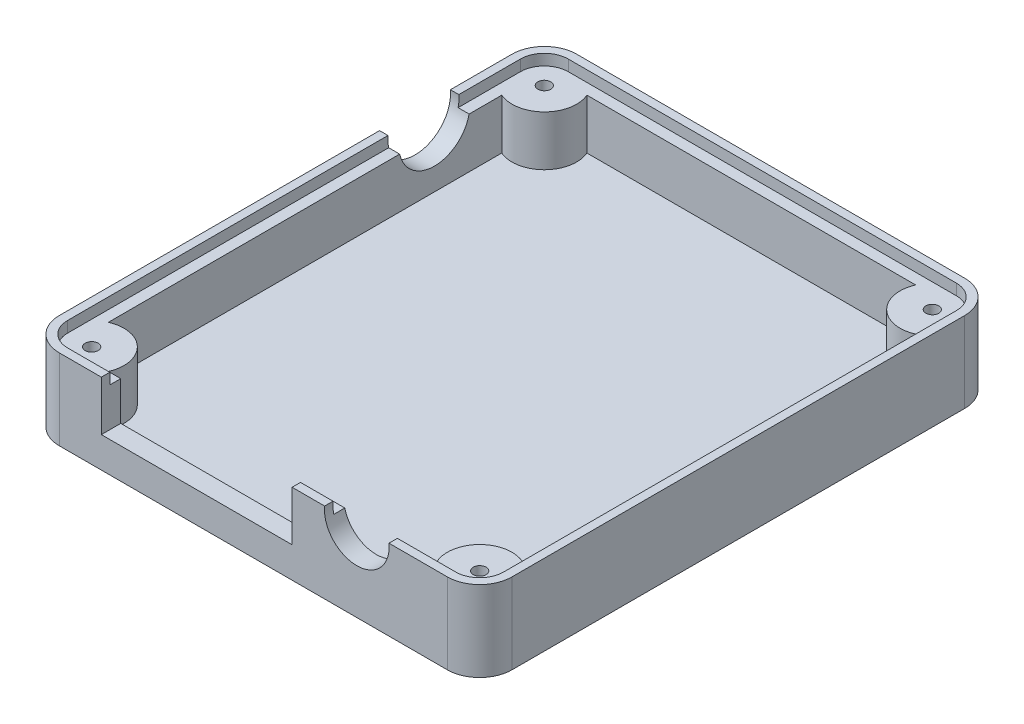
from build123d import *

# Parameters (mm, degrees)
SKETCH1_W               = 70
SKETCH1_H               = 80
BOSS_EXTRUDE1_DEPTH     = 21.5
FILLET1_R               = 5
SHELL1_T                = 3
BOSS_EXTRUDE2_REACH     = 59.335
SKETCH3_R               = 5
SPLIT2_SURFACE_1_BACK   = 109.454
SPLIT2_SURFACE_1_DEPTH  = 218.908
SPLIT2_SURFACE_2_BACK   = 109.454
SPLIT2_SURFACE_2_DEPTH  = 218.908
SKETCH4_R               = 1
CUT_EXTRUDE1_DEPTH      = 58.334544561
SKETCH5_R               = 3
CUT_EXTRUDE2_DEPTH      = 7.75
SKETCH6_OUTSIDE_W       = 93.69
SKETCH6_OUTSIDE_H       = 103.69
CUT_EXTRUDE3_DEPTH      = 2
BOSS_EXTRUDE3_START     = 1.7
BOSS_EXTRUDE3_DEPTH     = 1.7
SKETCH8_R               = 5.5
CUT_EXTRUDE4_DEPTH      = 10
SKETCH9_R               = 5
SKETCH9_W               = 20
SKETCH9_H               = 12
CUT_EXTRUDE5_DEPTH      = 10
BOSS_EXTRUDE4_OUTLINE_W = 20
BOSS_EXTRUDE4_OUTLINE_H = 1.5
BOSS_EXTRUDE4_DEPTH     = 7.75
SKETCH12_W              = 29.5
SKETCH12_H              = 12
CUT_EXTRUDE6_DEPTH      = 10
BOSS_EXTRUDE5_DEPTH     = 5


# Read off the part's stored shape, not the designer's step: Boss-Extrude4
with BuildPart() as part:
    # Sketch1 → Boss-Extrude1 (new body)
    with BuildSketch(Plane(origin=(0, 0, 0), x_dir=(1, 0, 0), z_dir=(0, 1, 0))):
        Rectangle(SKETCH1_W, SKETCH1_H)
    extrude(amount=BOSS_EXTRUDE1_DEPTH)

    # Fillet1
    fillet1_edges = [part.edges().sort_by_distance(p)[0] for p in [
        (-35, 10.75, -40),
        (35, 10.75, -40),
        (35, 10.75, 40),
        (-35, 10.75, 40),
    ]]
    fillet(fillet1_edges, radius=FILLET1_R)

    # Shell1 (no face opened: a closed hollow body)
    add(offset(amount=-SHELL1_T, mode=Mode.PRIVATE), mode=Mode.SUBTRACT)

    # Sketch3 → Boss-Extrude2 (add, up to next)
    with BuildSketch(Plane(origin=(0, 21.5, 0), x_dir=(1, 0, 0), z_dir=(0, 1, 0)), mode=Mode.PRIVATE) as boss_extrude2_sk1:
        with Locations((-30, 35)):
            Circle(SKETCH3_R)
    boss_extrude2_tool1 = extrude(boss_extrude2_sk1.sketch, amount=-BOSS_EXTRUDE2_REACH, mode=Mode.PRIVATE) - part.part
    # Sketch3 → Boss-Extrude2 (add, up to next)
    with BuildSketch(Plane(origin=(0, 21.5, 0), x_dir=(1, 0, 0), z_dir=(0, 1, 0)), mode=Mode.PRIVATE) as boss_extrude2_sk2:
        with Locations((30, 35)):
            Circle(SKETCH3_R)
    boss_extrude2_tool2 = extrude(boss_extrude2_sk2.sketch, amount=-BOSS_EXTRUDE2_REACH, mode=Mode.PRIVATE) - part.part
    # Sketch3 → Boss-Extrude2 (add, up to next)
    with BuildSketch(Plane(origin=(0, 21.5, 0), x_dir=(1, 0, 0), z_dir=(0, 1, 0)), mode=Mode.PRIVATE) as boss_extrude2_sk3:
        with Locations((30, -35)):
            Circle(SKETCH3_R)
    boss_extrude2_tool3 = extrude(boss_extrude2_sk3.sketch, amount=-BOSS_EXTRUDE2_REACH, mode=Mode.PRIVATE) - part.part
    # Sketch3 → Boss-Extrude2 (add, up to next)
    with BuildSketch(Plane(origin=(0, 21.5, 0), x_dir=(1, 0, 0), z_dir=(0, 1, 0)), mode=Mode.PRIVATE) as boss_extrude2_sk4:
        with Locations((-30, -35)):
            Circle(SKETCH3_R)
    boss_extrude2_tool4 = extrude(boss_extrude2_sk4.sketch, amount=-BOSS_EXTRUDE2_REACH, mode=Mode.PRIVATE) - part.part
    add(boss_extrude2_tool1.solids().sort_by_distance((-30, 21.5, -35))[0])
    add(boss_extrude2_tool2.solids().sort_by_distance((30, 21.5, -35))[0])
    add(boss_extrude2_tool3.solids().sort_by_distance((30, 21.5, 35))[0])
    add(boss_extrude2_tool4.solids().sort_by_distance((-30, 21.5, 35))[0])


with BuildPart() as body_2:
    # Split2: the piece behind the surface
    add(part.part)
    # Split2 surface: a surface, the sketch's curves swept straight by 218.908 mm
    with BuildLine(Plane(origin=(0, 0, 0), x_dir=(0, 0, -1), z_dir=(1, 0, 0)).offset(-SPLIT2_SURFACE_1_BACK), mode=Mode.PRIVATE) as split2_surface_1_path:
        Line((-40, 10.75), (51.562362236, 10.75))
    split2_surface_1 = Shell.extrude(split2_surface_1_path.wire(), (1 * SPLIT2_SURFACE_1_DEPTH, 0 * SPLIT2_SURFACE_1_DEPTH, 0 * SPLIT2_SURFACE_1_DEPTH))
    split(bisect_by=split2_surface_1, keep=Keep.BOTTOM)


with BuildPart() as part_1:
    add(part.part)

    # Split2: split by a surface, the side it looks to stays
    # Split2 surface: a surface, the sketch's curves swept straight by 218.908 mm
    with BuildLine(Plane(origin=(0, 0, 0), x_dir=(0, 0, -1), z_dir=(1, 0, 0)).offset(-SPLIT2_SURFACE_2_BACK), mode=Mode.PRIVATE) as split2_surface_2_path:
        Line((-40, 10.75), (51.562362236, 10.75))
    split2_surface_2 = Shell.extrude(split2_surface_2_path.wire(), (1 * SPLIT2_SURFACE_2_DEPTH, 0 * SPLIT2_SURFACE_2_DEPTH, 0 * SPLIT2_SURFACE_2_DEPTH))
    split(bisect_by=split2_surface_2, keep=Keep.TOP)


with BuildPart() as cut_extrude1_tool:
    # Sketch4 → Cut-Extrude1 (new, through all)
    with BuildSketch(Plane(origin=(0, 21.5, 0), x_dir=(1, 0, 0), z_dir=(0, 1, 0))):
        with Locations(Location((-30, 35, 0), (0, 0, 270))):
            Circle(SKETCH4_R)
        with Locations(Location((30, 35, 0), (0, 0, 270))):
            Circle(SKETCH4_R)
        with Locations(Location((30, -35, 0), (0, 0, 270))):
            Circle(SKETCH4_R)
        with Locations(Location((-30, -35, 0), (0, 0, 270))):
            Circle(SKETCH4_R)
    extrude(amount=-CUT_EXTRUDE1_DEPTH)


with BuildPart() as part_2:
    add(part_1.part)

    # Cut-Extrude1: cut by cut_extrude1_tool
    add(cut_extrude1_tool.part, mode=Mode.SUBTRACT)

    # Sketch5 → Cut-Extrude2 (cut)
    with BuildSketch(Plane(origin=(0, 21.5, 0), x_dir=(1, 0, 0), z_dir=(0, 1, 0))):
        with Locations(Location((-30, 35, 0), (0, 0, 270))):
            Circle(SKETCH5_R)
        with Locations(Location((30, 35, 0), (0, 0, 270))):
            Circle(SKETCH5_R)
        with Locations(Location((30, -35, 0), (0, 0, 270))):
            Circle(SKETCH5_R)
        with Locations(Location((-30, -35, 0), (0, 0, 270))):
            Circle(SKETCH5_R)
    extrude(amount=-CUT_EXTRUDE2_DEPTH, mode=Mode.SUBTRACT)

    # Sketch6 outside → Cut-Extrude3 (cut)
    with BuildSketch(Plane.XZ.offset(-10.75)):
        Rectangle(SKETCH6_OUTSIDE_W, SKETCH6_OUTSIDE_H)
        with BuildLine():
            Line((-30, -38.5), (30, -38.5))
            ThreePointArc((30, -38.5), (32.474873734, -37.474873734), (33.5, -35))
            Line((33.5, -35), (33.5, 35))
            ThreePointArc((33.5, 35), (32.474873734, 37.474873734), (30, 38.5))
            Line((30, 38.5), (-30, 38.5))
            ThreePointArc((-30, 38.5), (-32.474873734, 37.474873734), (-33.5, 35))
            Line((-33.5, 35), (-33.5, -35))
            ThreePointArc((-33.5, -35), (-32.474873734, -37.474873734), (-30, -38.5))
        make_face(mode=Mode.SUBTRACT)
    extrude(amount=-CUT_EXTRUDE3_DEPTH, mode=Mode.SUBTRACT)


with BuildPart() as body_2_1:
    add(body_2.part)

    # Cut-Extrude1: cut by cut_extrude1_tool
    add(cut_extrude1_tool.part, mode=Mode.SUBTRACT)

    # Sketch7 → Boss-Extrude3 (add)
    with BuildSketch(Plane(origin=(0, 10.75, 0), x_dir=(1, 0, 0), z_dir=(0, 1, 0)).offset(BOSS_EXTRUDE3_START)):
        with BuildLine():
            Line((-30, 40), (30, 40))
            ThreePointArc((30, 40), (33.535533906, 38.535533906), (35, 35))
            Line((35, 35), (35, -35))
            ThreePointArc((35, -35), (33.535533906, -38.535533906), (30, -40))
            Line((30, -40), (-30, -40))
            ThreePointArc((-30, -40), (-33.535533906, -38.535533906), (-35, -35))
            Line((-35, -35), (-35, 35))
            ThreePointArc((-35, 35), (-33.535533906, 38.535533906), (-30, 40))
        make_face()
        with BuildLine():
            Line((30, 38.7), (-30, 38.7))
            ThreePointArc((-30, 38.7), (-32.61629509, 37.61629509), (-33.7, 35))
            Line((-33.7, 35), (-33.7, -35))
            ThreePointArc((-33.7, -35), (-32.61629509, -37.61629509), (-30, -38.7))
            Line((-30, -38.7), (30, -38.7))
            ThreePointArc((30, -38.7), (32.61629509, -37.61629509), (33.7, -35))
            Line((33.7, -35), (33.7, 35))
            ThreePointArc((33.7, 35), (32.61629509, 37.61629509), (30, 38.7))
        make_face(mode=Mode.SUBTRACT)
    extrude(amount=-BOSS_EXTRUDE3_DEPTH)


with BuildPart() as cut_extrude4_tool:
    # Sketch8 → Cut-Extrude4 (new body)
    with BuildSketch(Plane.ZY.offset(35)):
        with Locations((-20, 11.95)):
            Circle(SKETCH8_R)
    extrude(amount=-CUT_EXTRUDE4_DEPTH)


with BuildPart() as part_3:
    add(part_2.part)

    # Cut-Extrude4: cut by cut_extrude4_tool
    add(cut_extrude4_tool.part, mode=Mode.SUBTRACT)


with BuildPart() as body_2_2:
    add(body_2_1.part)

    # Cut-Extrude4: cut by cut_extrude4_tool
    add(cut_extrude4_tool.part, mode=Mode.SUBTRACT)


with BuildPart() as cut_extrude5_tool:
    # Sketch9 → Cut-Extrude5 (new body)
    with BuildSketch(Plane.XY.offset(40)):
        with Locations((16, 11.95)):
            Circle(SKETCH9_R)
        with Locations((-10, 10.75)):
            Rectangle(SKETCH9_W, SKETCH9_H)
    extrude(amount=-CUT_EXTRUDE5_DEPTH)


with BuildPart() as part_4:
    add(part_3.part)

    # Cut-Extrude5: cut by cut_extrude5_tool
    add(cut_extrude5_tool.part, mode=Mode.SUBTRACT)

    # Boss-Extrude4 outline → Boss-Extrude4 (add)
    with BuildSketch(Plane.XZ.offset(-18.5)):
        Polygon((10.5, 37), (7.5, 37), (7.5, 35), (6, 35), (6, 32), (10.5, 32), align=None)
        with Locations((-10, 37.75)):
            Rectangle(BOSS_EXTRUDE4_OUTLINE_W, BOSS_EXTRUDE4_OUTLINE_H)
        with BuildLine():
            Line((-23.5, 35), (-25, 35))
            ThreePointArc((-25, 35), (-25.25658351, 33.41886117), (-26, 32))
            Line((-26, 32), (-23.5, 32))
            Line((-23.5, 32), (-23.5, 35))
        make_face()
        with BuildLine():
            Line((-25, 35), (-25, 37))
            Line((-25, 37), (-25.417424305, 37))
            ThreePointArc((-25.417424305, 37), (-25.105468435, 36.021548218), (-25, 35))
        make_face()
        with BuildLine():
            Line((-28, 37.236067977), (-28, 32.763932023))
            ThreePointArc((-28, 32.763932023), (-27, 35), (-28, 37.236067977))
        make_face()
    extrude(amount=BOSS_EXTRUDE4_DEPTH)


with BuildPart() as body_2_3:
    add(body_2_2.part)

    # Cut-Extrude5: cut by cut_extrude5_tool
    add(cut_extrude5_tool.part, mode=Mode.SUBTRACT)


with BuildPart() as cut_extrude6_tool:
    # Sketch12 → Cut-Extrude6 (new body)
    with BuildSketch(Plane(origin=(0, 0, 37), x_dir=(-1, 0, 0), z_dir=(0, 0, -1))):
        with Locations((8.75, 10.75)):
            Rectangle(SKETCH12_W, SKETCH12_H)
    extrude(amount=-CUT_EXTRUDE6_DEPTH)


with BuildPart() as part_5:
    add(part_4.part)

    # Cut-Extrude6: cut by cut_extrude6_tool
    add(cut_extrude6_tool.part, mode=Mode.SUBTRACT)

    # Sketch14 → Boss-Extrude5 (add)
    with BuildSketch(Plane.XZ.offset(-10.75)):
        Polygon((10.5, 36.8), (7.5, 36.8), (7.5, 35), (6, 35), (6, 32), (10.5, 32), align=None)
    extrude(amount=BOSS_EXTRUDE5_DEPTH)


with BuildPart() as body_2_4:
    add(body_2_3.part)

    # Cut-Extrude6: cut by cut_extrude6_tool
    add(cut_extrude6_tool.part, mode=Mode.SUBTRACT)


solid = body_2_4.part
